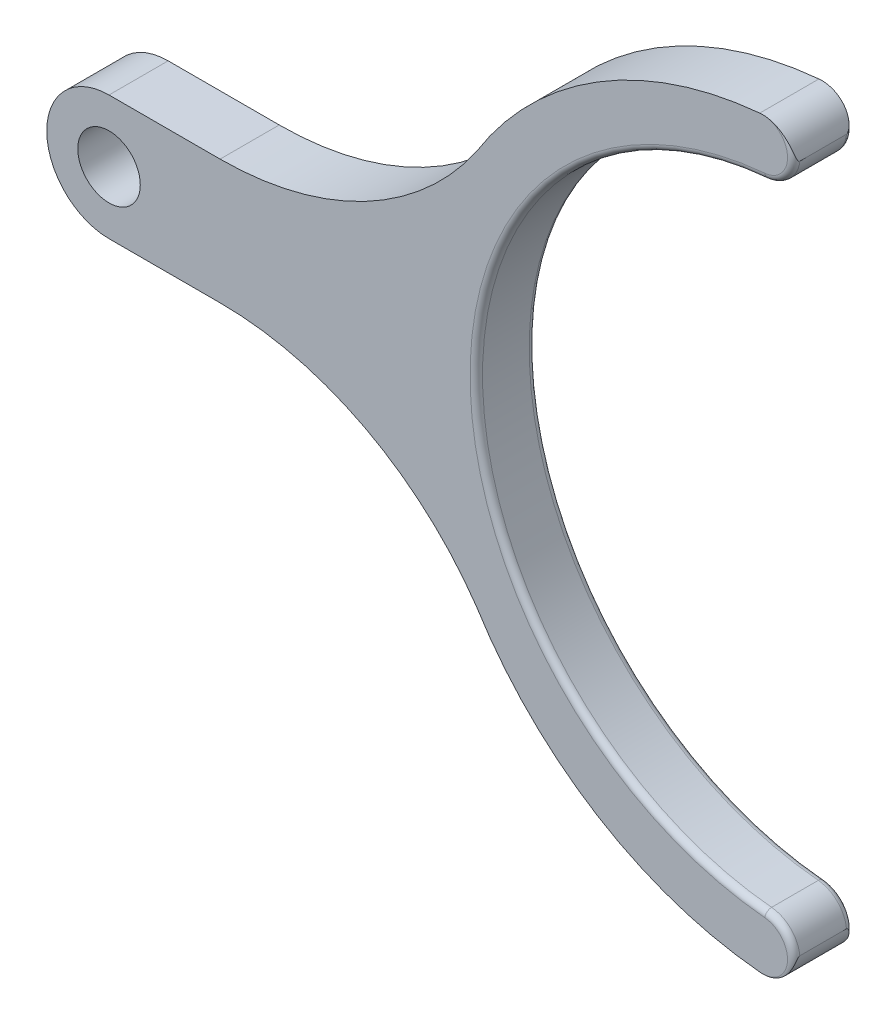
from build123d import *

# Parameters (mm, degrees)
SKETCH1_R           = 5.02
BOSS_EXTRUDE1_DEPTH = 4.75
FILLET2_R           = 5
FILLET3_R           = 1


with BuildPart() as part:
    # Sketch1 → Boss-Extrude1 (new, symmetric)
    with BuildSketch(Plane.XY):
        with BuildLine():
            Line((51, -60), (51, -51))
            ThreePointArc((51, -51), (0, 0), (51, 51))
            Line((51, 51), (51, 60))
            ThreePointArc((51, 60), (21.814538512, 52.423361565), (0, 31.606961259))
            ThreePointArc((0, 31.606961259), (-17.914586674, 15.730078286), (-41.156231011, 10))
            Line((-41.156231011, 10), (-59, 10))
            ThreePointArc((-59, 10), (-69, 0), (-59, -10))
            Line((-59, -10), (-41.156231011, -10))
            ThreePointArc((-41.156231011, -10), (-17.914586674, -15.730078286), (0, -31.606961259))
            ThreePointArc((0, -31.606961259), (21.814538512, -52.423361565), (51, -60))
        make_face()
        with Locations((-59, 0)):
            Circle(SKETCH1_R, mode=Mode.SUBTRACT)
    extrude(amount=BOSS_EXTRUDE1_DEPTH, both=True)

    # Fillet2
    # the kernel refuses this fillet: 5 mm, written as the material it takes off along each edge
    with BuildSketch(Plane(origin=(51, -60, 18.400501973), x_dir=(0, 1, 0), z_dir=(0, 0, -1))) as fillet2_piece_1:
        with BuildLine():
            CenterArc((5.227744249, -5), FILLET2_R, 90, 95.21590857)
            ThreePointArc((0.248448272, -5.454545455), (0.062144251, -2.730100395), (0, 0))
            Line((0, 0), (5.227744249, 0))
        make_face()
    extrude(amount=36.801003947, mode=Mode.SUBTRACT)
    with BuildSketch(Plane(origin=(51, -51, -16.690847674), x_dir=(0, -1, 0), z_dir=(0, 0, 1))) as fillet2_piece_2:
        with BuildLine():
            CenterArc((4.77633907, -5), FILLET2_R, 90, 84.8774839)
            ThreePointArc((-0.203691205, -4.553571429), (-0.050948249, -2.279062464), (0, 0))
            Line((0, 0), (4.77633907, 0))
        make_face()
    extrude(amount=33.381695348, mode=Mode.SUBTRACT)
    with BuildSketch(Plane(origin=(51, 60, -18.400501973), x_dir=(-0.9989642624898897, -0.04550167324429649, 0), z_dir=(0, 0, 1))) as fillet2_piece_3:
        with BuildLine():
            CenterArc((5.232692423, 4.994821312), FILLET2_R, 177.392045715, 95.21590857)
            Line((0.237871111, 5.222329679), (0, 0))
            ThreePointArc((0, 0), (2.730100395, -0.062144251), (5.460200789, 0))
        make_face()
    extrude(amount=36.801003947, mode=Mode.SUBTRACT)
    with BuildSketch(Plane(origin=(51, 51, -16.690847674), x_dir=(0, 1, 0), z_dir=(0, 0, 1))) as fillet2_piece_4:
        with BuildLine():
            CenterArc((4.77633907, 5), FILLET2_R, 185.1225161, 84.8774839)
            ThreePointArc((-0.203691205, 4.553571429), (-0.050948249, 2.279062464), (0, 0))
            Line((0, 0), (4.77633907, 0))
        make_face()
    extrude(amount=33.381695348, mode=Mode.SUBTRACT)

    # Fillet3
    fillet3_edges = [part.edges().sort_by_distance(p)[0] for p in [
        (0, 0, -4.75),
        (49.515727495, 52.221109094, -4.75),
        (49.515727495, -52.221109094, -4.75),
        (0, 0, 4.75),
        (49.515727495, 52.221109094, 4.75),
        (49.515727495, -52.221109094, 4.75),
    ]]
    fillet(fillet3_edges, radius=FILLET3_R)


solid = part.part
